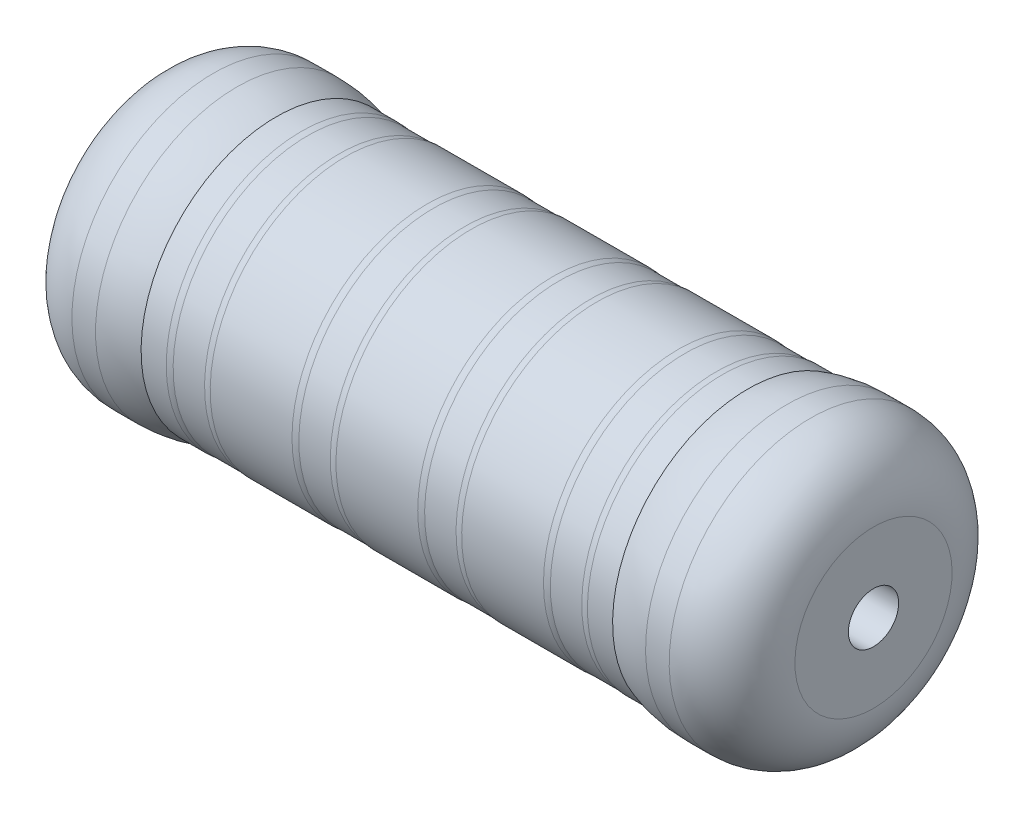
from build123d import *

# Parameters (mm, degrees)
FILLET2_R          = 1
FILLET10_R         = 0.5
FILLET11_R         = 2
SKETCH3_R          = 0.4
CUT_EXTRUDE2_DEPTH = 16


with BuildPart() as part:
    # Sketch2 → Revolve1 (revolve)
    with BuildSketch(Plane.XY, mode=Mode.PRIVATE) as revolve1_sk:
        Polygon((-6.558139535, 2.25), (-6.558139535, 0), (4.941860465, 0), (4.941860465, 2.25), (2.941860465, 2.25), (2.941860465, 2.15), (2.441860465, 2.15), (2.441860465, 2.14), (1.941860465, 2.14), (1.941860465, 2.15), (1.442088765, 2.15), (0.441860465, 2.15), (0.441860465, 2.14), (-0.058139535, 2.14), (-0.058139535, 2.15), (-1.558139535, 2.15), (-1.558139535, 2.14), (-2.058139535, 2.14), (-2.058139535, 2.15), (-3.558139535, 2.15), (-3.558139535, 2.14), (-4.058139535, 2.14), (-4.058139535, 2.15), (-4.558139535, 2.15), (-4.558139535, 2.25), align=None)
    revolve(revolve1_sk.sketch.rotate(Axis((-6.558139535, 0, 0), (1, 0, 0)), 180), axis=Axis((-6.558139535, 0, 0), (1, 0, 0)))

    # Fillet2
    fillet2_edges = [part.edges().sort_by_distance(p)[0] for p in [
        (-6.558139535, 2.25, 0),
        (4.941860465, 2.25, 0),
    ]]
    fillet(fillet2_edges, radius=FILLET2_R)

    # Fillet10
    # the kernel refuses this fillet: 0.5 mm, written as the material it takes off along each edge
    with BuildSketch(Plane(origin=(-4.058139535, 0, 0), x_dir=(0, -1, 0), z_dir=(0, 0, 1))) as fillet10_piece_1:
        with BuildLine():
            CenterArc((1.65, -0.099498744), FILLET10_R, 0, 11.478340955)
            Line((2.14, 0), (2.1498, 0.001989975))
            ThreePointArc((2.1498, 0.001989975), (2.145, 0.01), (2.15, 0.01))
            Line((2.15, 0.01), (2.16, 0))
            Line((2.16, 0), (2.16, -0.099498744))
            Line((2.16, -0.099498744), (2.15, -0.099498744))
        make_face()
    revolve(axis=Axis((-4.058139535, 0, 0), (1, 0, 0)), mode=Mode.SUBTRACT)
    with BuildSketch(Plane(origin=(-3.558139535, 0, 0), x_dir=(0, -1, 0), z_dir=(0, 0, 1))) as fillet10_piece_2:
        with BuildLine():
            CenterArc((1.65, 0.099498744), FILLET10_R, 348.521659045, 11.478340955)
            Line((2.15, 0.099498744), (2.16, 0.099498744))
            Line((2.16, 0.099498744), (2.16, 0))
            Line((2.16, 0), (2.15, -0.01))
            ThreePointArc((2.15, -0.01), (2.145, -0.01), (2.1498, -0.001989975))
            Line((2.1498, -0.001989975), (2.14, 0))
        make_face()
    revolve(axis=Axis((-3.558139535, 0, 0), (1, 0, 0)), mode=Mode.SUBTRACT)
    with BuildSketch(Plane(origin=(-2.058139535, 0, 0), x_dir=(0, -1, 0), z_dir=(0, 0, 1))) as fillet10_piece_3:
        with BuildLine():
            CenterArc((1.65, -0.099498744), FILLET10_R, 0, 11.478340955)
            Line((2.14, 0), (2.1498, 0.001989975))
            ThreePointArc((2.1498, 0.001989975), (2.145, 0.01), (2.15, 0.01))
            Line((2.15, 0.01), (2.16, 0))
            Line((2.16, 0), (2.16, -0.099498744))
            Line((2.16, -0.099498744), (2.15, -0.099498744))
        make_face()
    revolve(axis=Axis((-2.058139535, 0, 0), (1, 0, 0)), mode=Mode.SUBTRACT)
    with BuildSketch(Plane(origin=(-1.558139535, 0, 0), x_dir=(0, -1, 0), z_dir=(0, 0, 1))) as fillet10_piece_4:
        with BuildLine():
            CenterArc((1.65, 0.099498744), FILLET10_R, 348.521659045, 11.478340955)
            Line((2.15, 0.099498744), (2.16, 0.099498744))
            Line((2.16, 0.099498744), (2.16, 0))
            Line((2.16, 0), (2.15, -0.01))
            ThreePointArc((2.15, -0.01), (2.145, -0.01), (2.1498, -0.001989975))
            Line((2.1498, -0.001989975), (2.14, 0))
        make_face()
    revolve(axis=Axis((-1.558139535, 0, 0), (1, 0, 0)), mode=Mode.SUBTRACT)
    with BuildSketch(Plane(origin=(-0.058139535, 0, 0), x_dir=(0, -1, 0), z_dir=(0, 0, 1))) as fillet10_piece_5:
        with BuildLine():
            CenterArc((1.65, -0.099498744), FILLET10_R, 0, 11.478340955)
            Line((2.14, 0), (2.1498, 0.001989975))
            ThreePointArc((2.1498, 0.001989975), (2.145, 0.01), (2.15, 0.01))
            Line((2.15, 0.01), (2.16, 0))
            Line((2.16, 0), (2.16, -0.099498744))
            Line((2.16, -0.099498744), (2.15, -0.099498744))
        make_face()
    revolve(axis=Axis((-0.058139535, 0, 0), (1, 0, 0)), mode=Mode.SUBTRACT)
    with BuildSketch(Plane(origin=(0.441860465, 0, 0), x_dir=(0, -1, 0), z_dir=(0, 0, 1))) as fillet10_piece_6:
        with BuildLine():
            CenterArc((1.65, 0.099498744), FILLET10_R, 348.521659045, 11.478340955)
            Line((2.15, 0.099498744), (2.16, 0.099498744))
            Line((2.16, 0.099498744), (2.16, 0))
            Line((2.16, 0), (2.15, -0.01))
            ThreePointArc((2.15, -0.01), (2.145, -0.01), (2.1498, -0.001989975))
            Line((2.1498, -0.001989975), (2.14, 0))
        make_face()
    revolve(axis=Axis((0.441860465, 0, 0), (1, 0, 0)), mode=Mode.SUBTRACT)
    with BuildSketch(Plane(origin=(1.941860465, 0, 0), x_dir=(0, -1, 0), z_dir=(0, 0, 1))) as fillet10_piece_7:
        with BuildLine():
            CenterArc((1.65, -0.099498744), FILLET10_R, 0, 11.478340955)
            Line((2.14, 0), (2.1498, 0.001989975))
            ThreePointArc((2.1498, 0.001989975), (2.145, 0.01), (2.15, 0.01))
            Line((2.15, 0.01), (2.16, 0))
            Line((2.16, 0), (2.16, -0.099498744))
            Line((2.16, -0.099498744), (2.15, -0.099498744))
        make_face()
    revolve(axis=Axis((1.941860465, 0, 0), (1, 0, 0)), mode=Mode.SUBTRACT)
    with BuildSketch(Plane(origin=(2.441860465, 0, 0), x_dir=(0, -1, 0), z_dir=(0, 0, 1))) as fillet10_piece_8:
        with BuildLine():
            CenterArc((1.65, 0.099498744), FILLET10_R, 348.521659045, 11.478340955)
            Line((2.15, 0.099498744), (2.16, 0.099498744))
            Line((2.16, 0.099498744), (2.16, 0))
            Line((2.16, 0), (2.15, -0.01))
            ThreePointArc((2.15, -0.01), (2.145, -0.01), (2.1498, -0.001989975))
            Line((2.1498, -0.001989975), (2.14, 0))
        make_face()
    revolve(axis=Axis((2.441860465, 0, 0), (1, 0, 0)), mode=Mode.SUBTRACT)

    # Fillet11
    # the kernel refuses this fillet: 2 mm, written as the material it takes off along each edge
    with BuildSketch(Plane(origin=(-4.558139535, 0, 0), x_dir=(0, -1, 0), z_dir=(0, 0, 1))) as fillet11_piece_1:
        with BuildLine():
            CenterArc((0.25, -0.6244998), FILLET11_R, 0, 18.194872339)
            Line((2.15, 0), (2.25, 0))
            Line((2.25, 0), (2.25, -0.6244998))
        make_face()
    revolve(axis=Axis((-4.558139535, 0, 0), (1, 0, 0)), mode=Mode.SUBTRACT)
    with BuildSketch(Plane(origin=(2.941860465, 0, 0), x_dir=(0, -1, 0), z_dir=(0, 0, 1))) as fillet11_piece_2:
        with BuildLine():
            CenterArc((0.25, 0.6244998), FILLET11_R, 341.805127661, 18.194872339)
            Line((2.25, 0.6244998), (2.25, 0))
            Line((2.25, 0), (2.15, 0))
        make_face()
    revolve(axis=Axis((2.941860465, 0, 0), (1, 0, 0)), mode=Mode.SUBTRACT)

    # Sketch3 → Cut-Extrude2 (cut)
    with BuildSketch(Plane.ZY.offset(6.558139535)):
        with Locations(Location((0, 0, 0), (0, 0, 270))):
            Circle(SKETCH3_R)
    extrude(amount=-CUT_EXTRUDE2_DEPTH, mode=Mode.SUBTRACT)


solid = part.part
